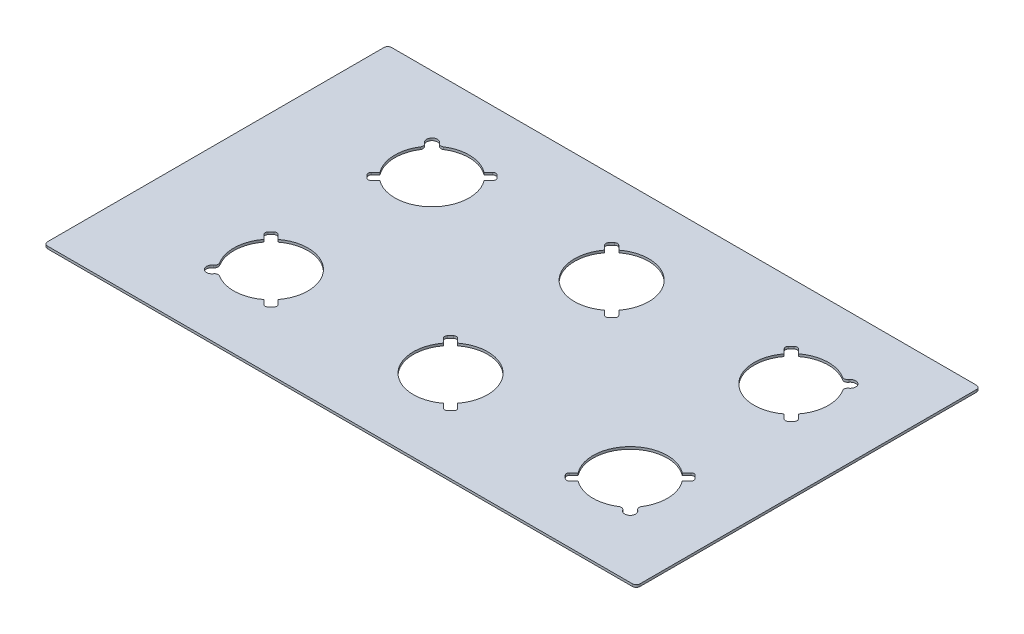
from build123d import *

# Parameters (mm, degrees)
SKETCH1_W                       = 368.3
SKETCH1_H                       = 228.6
BOSS_EXTRUDE1_DEPTH             = 1.5748
SKETCH2_W                       = 228.6
SKETCH2_H                       = 1.5748
BOSS_EXTRUDE2_DEPTH             = 25.4
CUT_EXTRUDE1_DEPTH              = 239.70101067
F_9_32_0_28125_DIAMETER_HOLE1_D = 7.14375
FILLET1_R                       = 2.54


with BuildPart() as part:
    # Sketch1 → Boss-Extrude1 (new body)
    with BuildSketch(Plane(origin=(0, 0, 0), x_dir=(1, 0, 0), z_dir=(0, 1, 0))):
        Rectangle(SKETCH1_W, SKETCH1_H)
    extrude(amount=BOSS_EXTRUDE1_DEPTH)

    # Sketch2 → Boss-Extrude2 (add)
    with BuildSketch(Plane.ZY.offset(184.15)):
        with Locations((0, 0.7874)):
            Rectangle(SKETCH2_W, SKETCH2_H)
    extrude(amount=BOSS_EXTRUDE2_DEPTH)

    # Sketch3 → Cut-Extrude1 (cut, through all)
    with BuildSketch(Plane.XZ):
        with BuildLine():
            Line((141.91869864, -35.729416794), (139.054032394, -38.59408304))
            ThreePointArc((139.054032394, -38.59408304), (136.846598155, -70.997098155), (104.44358304, -73.204532394))
            Line((104.44358304, -73.204532394), (101.578916794, -76.06919864))
            ThreePointArc((101.578916794, -76.06919864), (100.164703231, -76.654985078), (98.750489669, -76.06919864))
            Line((98.750489669, -76.06919864), (96.84130136, -74.160010331))
            ThreePointArc((96.84130136, -74.160010331), (96.255514922, -72.745796769), (96.84130136, -71.331583206))
            Line((96.84130136, -71.331583206), (99.705967606, -68.46691696))
            ThreePointArc((99.705967606, -68.46691696), (101.913401845, -36.063901845), (134.31641696, -33.856467606))
            Line((134.31641696, -33.856467606), (137.181083206, -30.99180136))
            ThreePointArc((137.181083206, -30.99180136), (138.595296769, -30.406014922), (140.009510331, -30.99180136))
            Line((140.009510331, -30.99180136), (141.91869864, -32.900989669))
            ThreePointArc((141.91869864, -32.900989669), (142.504485078, -34.315203231), (141.91869864, -35.729416794))
        make_face()
        with BuildLine():
            Line((22.53869864, -35.729416794), (19.674032394, -38.59408304))
            ThreePointArc((19.674032394, -38.59408304), (17.466598155, -70.997098155), (-14.93641696, -73.204532394))
            Line((-14.93641696, -73.204532394), (-17.801083206, -76.06919864))
            ThreePointArc((-17.801083206, -76.06919864), (-19.215296769, -76.654985078), (-20.629510331, -76.06919864))
            Line((-20.629510331, -76.06919864), (-22.53869864, -74.160010331))
            ThreePointArc((-22.53869864, -74.160010331), (-23.124485078, -72.745796769), (-22.53869864, -71.331583206))
            Line((-22.53869864, -71.331583206), (-19.674032394, -68.46691696))
            ThreePointArc((-19.674032394, -68.46691696), (-17.466598155, -36.063901845), (14.93641696, -33.856467606))
            Line((14.93641696, -33.856467606), (17.801083206, -30.99180136))
            ThreePointArc((17.801083206, -30.99180136), (19.215296769, -30.406014922), (20.629510331, -30.99180136))
            Line((20.629510331, -30.99180136), (22.53869864, -32.900989669))
            ThreePointArc((22.53869864, -32.900989669), (23.124485078, -34.315203231), (22.53869864, -35.729416794))
        make_face()
        with BuildLine():
            Line((-137.181083206, -30.99180136), (-134.31641696, -33.856467606))
            ThreePointArc((-134.31641696, -33.856467606), (-101.913401845, -36.063901845), (-99.705967606, -68.46691696))
            Line((-99.705967606, -68.46691696), (-96.84130136, -71.331583206))
            ThreePointArc((-96.84130136, -71.331583206), (-96.255514922, -72.745796769), (-96.84130136, -74.160010331))
            Line((-96.84130136, -74.160010331), (-98.750489669, -76.06919864))
            ThreePointArc((-98.750489669, -76.06919864), (-100.164703231, -76.654985078), (-101.578916794, -76.06919864))
            Line((-101.578916794, -76.06919864), (-104.44358304, -73.204532394))
            ThreePointArc((-104.44358304, -73.204532394), (-136.846598155, -70.997098155), (-139.054032394, -38.59408304))
            Line((-139.054032394, -38.59408304), (-141.91869864, -35.729416794))
            ThreePointArc((-141.91869864, -35.729416794), (-142.504485078, -34.315203231), (-141.91869864, -32.900989669))
            Line((-141.91869864, -32.900989669), (-140.009510331, -30.99180136))
            ThreePointArc((-140.009510331, -30.99180136), (-138.595296769, -30.406014922), (-137.181083206, -30.99180136))
        make_face()
        with BuildLine():
            Line((-134.31641696, 33.856467606), (-137.181083206, 30.99180136))
            ThreePointArc((-137.181083206, 30.99180136), (-138.595296769, 30.406014922), (-140.009510331, 30.99180136))
            Line((-140.009510331, 30.99180136), (-141.91869864, 32.900989669))
            ThreePointArc((-141.91869864, 32.900989669), (-142.504485078, 34.315203231), (-141.91869864, 35.729416794))
            Line((-141.91869864, 35.729416794), (-139.054032394, 38.59408304))
            ThreePointArc((-139.054032394, 38.59408304), (-136.846598155, 70.997098155), (-104.44358304, 73.204532394))
            Line((-104.44358304, 73.204532394), (-101.578916794, 76.06919864))
            ThreePointArc((-101.578916794, 76.06919864), (-100.164703231, 76.654985078), (-98.750489669, 76.06919864))
            Line((-98.750489669, 76.06919864), (-96.84130136, 74.160010331))
            ThreePointArc((-96.84130136, 74.160010331), (-96.255514922, 72.745796769), (-96.84130136, 71.331583206))
            Line((-96.84130136, 71.331583206), (-99.705967606, 68.46691696))
            ThreePointArc((-99.705967606, 68.46691696), (-101.913401845, 36.063901845), (-134.31641696, 33.856467606))
        make_face()
        with BuildLine():
            Line((14.93641696, 73.204532394), (17.801083206, 76.06919864))
            ThreePointArc((17.801083206, 76.06919864), (19.215296769, 76.654985078), (20.629510331, 76.06919864))
            Line((20.629510331, 76.06919864), (22.53869864, 74.160010331))
            ThreePointArc((22.53869864, 74.160010331), (23.124485078, 72.745796769), (22.53869864, 71.331583206))
            Line((22.53869864, 71.331583206), (19.674032394, 68.46691696))
            ThreePointArc((19.674032394, 68.46691696), (17.466598155, 36.063901845), (-14.93641696, 33.856467606))
            Line((-14.93641696, 33.856467606), (-17.801083206, 30.99180136))
            ThreePointArc((-17.801083206, 30.99180136), (-19.215296769, 30.406014922), (-20.629510331, 30.99180136))
            Line((-20.629510331, 30.99180136), (-22.53869864, 32.900989669))
            ThreePointArc((-22.53869864, 32.900989669), (-23.124485078, 34.315203231), (-22.53869864, 35.729416794))
            Line((-22.53869864, 35.729416794), (-19.674032394, 38.59408304))
            ThreePointArc((-19.674032394, 38.59408304), (-17.466598155, 70.997098155), (14.93641696, 73.204532394))
        make_face()
        with BuildLine():
            Line((101.578916794, 76.06919864), (104.44358304, 73.204532394))
            ThreePointArc((104.44358304, 73.204532394), (136.846598155, 70.997098155), (139.054032394, 38.59408304))
            Line((139.054032394, 38.59408304), (141.91869864, 35.729416794))
            ThreePointArc((141.91869864, 35.729416794), (142.504485078, 34.315203231), (141.91869864, 32.900989669))
            Line((141.91869864, 32.900989669), (140.009510331, 30.99180136))
            ThreePointArc((140.009510331, 30.99180136), (138.595296769, 30.406014922), (137.181083206, 30.99180136))
            Line((137.181083206, 30.99180136), (134.31641696, 33.856467606))
            ThreePointArc((134.31641696, 33.856467606), (101.913401845, 36.063901845), (99.705967606, 68.46691696))
            Line((99.705967606, 68.46691696), (96.84130136, 71.331583206))
            ThreePointArc((96.84130136, 71.331583206), (96.255514922, 72.745796769), (96.84130136, 74.160010331))
            Line((96.84130136, 74.160010331), (98.750489669, 76.06919864))
            ThreePointArc((98.750489669, 76.06919864), (100.164703231, 76.654985078), (101.578916794, 76.06919864))
        make_face()
    extrude(amount=-CUT_EXTRUDE1_DEPTH, mode=Mode.SUBTRACT)

    # 9/32 (0.28125) Diameter Hole1 (through all)
    with Locations(Plane(origin=(0, 0, 0), x_dir=(-1, 0, 0), z_dir=(0, -1, 0))):
        with Locations((-139.0015, 73.152), (139.0015, 73.152), (139.0015, -73.152), (-139.0015, -73.152)):
            Hole(F_9_32_0_28125_DIAMETER_HOLE1_D / 2)

    # Fillet1
    fillet1_edges = [part.edges().sort_by_distance(p)[0] for p in [
        (-209.55, 0.7874, -114.3),
        (-209.55, 0.7874, 114.3),
        (-138.04454174, 0.7874, 69.710703456),
        (-135.560203456, 0.7874, 72.19504174),
        (-138.04454174, 0.7874, -69.710703456),
        (-135.560203456, 0.7874, -72.19504174),
        (135.560203456, 0.7874, -72.19504174),
        (138.04454174, 0.7874, -69.710703456),
        (138.04454174, 0.7874, 69.710703456),
        (135.560203456, 0.7874, 72.19504174),
        (184.15, 0.7874, 114.3),
        (184.15, 0.7874, -114.3),
    ]]
    fillet(fillet1_edges, radius=FILLET1_R)


solid = part.part
